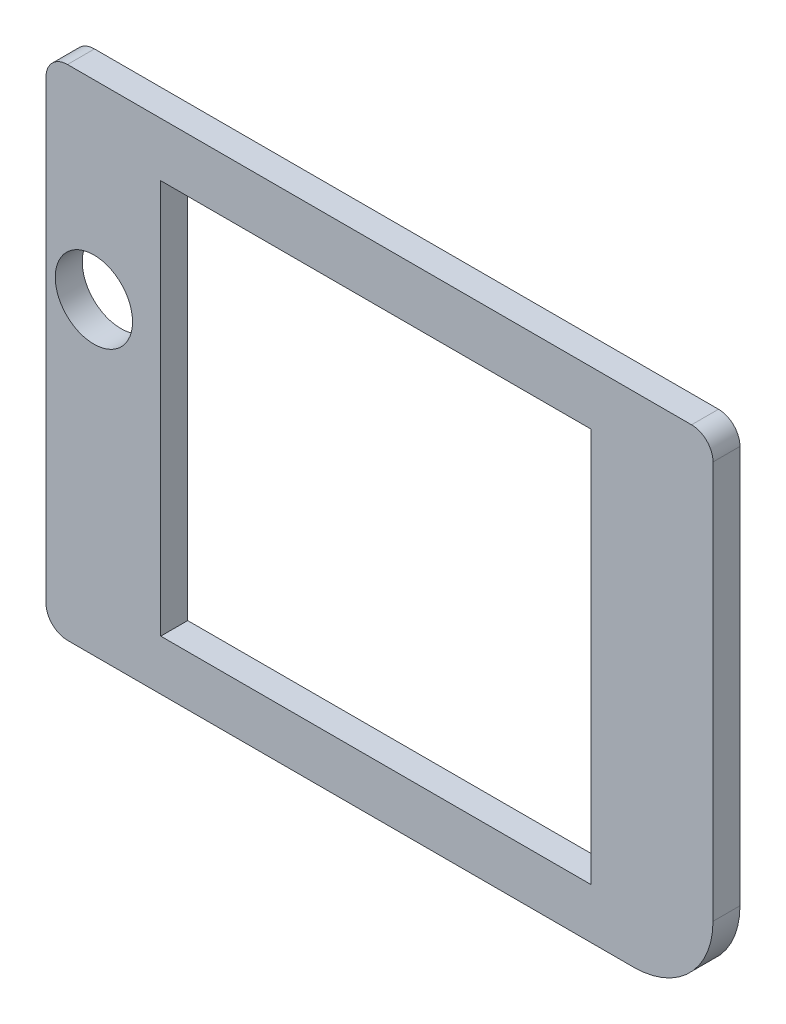
from build123d import *

# Parameters (mm, degrees)
SKETCH1_3_W         = 50.090098238
SKETCH1_3_H         = 45.92830966
SKETCH1_3_R         = 4.5
BOSS_EXTRUDE2_DEPTH = 3.14


with BuildPart() as part:
    # Sketch1<3> → Boss-Extrude2 (new body)
    with BuildSketch(Plane.XY):
        with BuildLine():
            Line((39.139308268, 13.683084381), (39.139308268, 60.005147218))
            ThreePointArc((39.139308268, 60.005147218), (38.40707522, 61.772914171), (36.639308268, 62.505147218))
            Line((36.639308268, 62.505147218), (-36.027217939, 62.505147218))
            ThreePointArc((-36.027217939, 62.505147218), (-37.794984892, 61.772914171), (-38.527217939, 60.005147218))
            Line((-38.527217939, 60.005147218), (-38.527217939, 6.933084381))
            ThreePointArc((-38.527217939, 6.933084381), (-37.794984892, 5.165317428), (-36.027217939, 4.433084381))
            Line((-36.027217939, 4.433084381), (29.889308268, 4.433084381))
            ThreePointArc((29.889308268, 4.433084381), (36.430045993, 7.142346655), (39.139308268, 13.683084381))
        make_face()
        with Locations((-0.122821054, 33.25213261)):
            Rectangle(SKETCH1_3_W, SKETCH1_3_H, mode=Mode.SUBTRACT)
        with Locations((-32.953932198, 40.341063425)):
            Circle(SKETCH1_3_R, mode=Mode.SUBTRACT)
    extrude(amount=BOSS_EXTRUDE2_DEPTH)


solid = part.part
